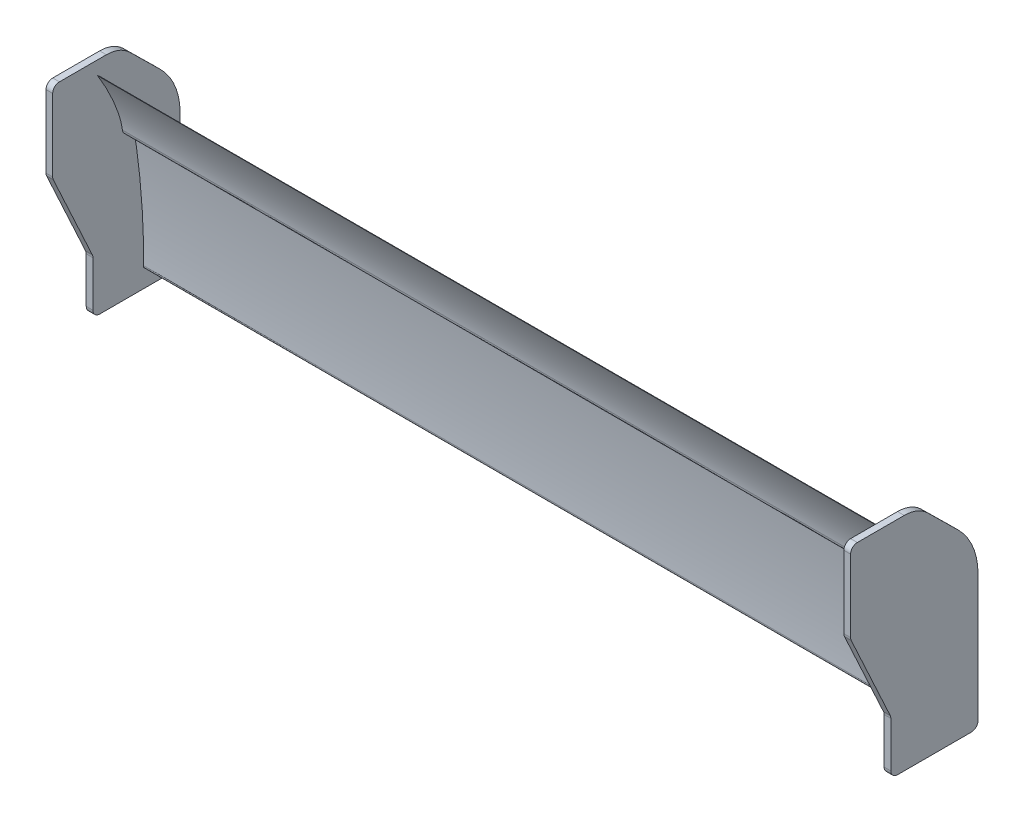
from build123d import *

# Parameters (mm, degrees)
AUFSATZ_LINEAR_AUSTRAGEN1_DEPTH = 1200
AUFSATZ_LINEAR_AUSTRAGEN2_DEPTH = 10
VERRUNDUNG1_R                   = 10
VERRUNDUNG2_R                   = 10
VERRUNDUNG3_R                   = 10
VERRUNDUNG4_R                   = 10
VERRUNDUNG5_R                   = 10
VERRUNDUNG6_R                   = 10
VERRUNDUNG7_R                   = 10
VERRUNDUNG8_R                   = 10
VERRUNDUNG9_R                   = 10


# Read off the part's stored shape, not the designer's step: Aufsatz-Linear austragen1
with BuildPart() as part:
    # Aufsatz-Linear austragen1 outline → Aufsatz-Linear austragen1 (new body)
    with BuildSketch(Plane.YZ):
        with BuildLine():
            add(Edge.make_bspline(
                [(0.087119677, 4.714982833), (-5.634033384, 4.866536556), (-4.617943663, -0.517961985), (1.551321063, -1.685315818)],
                knots=[0, 0, 0, 0, 1, 1, 1, 1], degree=3))
            add(Edge.make_bspline(
                [(1.551321063, -1.685315818), (36.200387324, -8.241643369), (130.194419575, -4.980681367), (200.000031119, 21.83636299)],
                knots=[0, 0, 0, 0, 1, 1, 1, 1], degree=3))
            add(Edge.make_bspline(
                [(200.000031119, 21.83636299), (128.317866722, 8.496380037), (49.556107203, 3.404546077), (0.087119677, 4.714982833)],
                knots=[0, 0, 0, 0, 1, 1, 1, 1], degree=3))
        make_face()
        with BuildLine():
            add(Edge.make_bspline(
                [(190.780024332, 35.996685389), (184.294419724, 35.173304352), (183.469094432, 31.558045666), (191.596944862, 31.529967587)],
                knots=[0, 0, 0, 0, 1, 1, 1, 1], degree=3))
            add(Edge.make_bspline(
                [(191.596944862, 31.529967587), (215.049703063, 31.448948823), (266.512020936, 54.325936425), (279.574089528, 73.098484798)],
                knots=[0, 0, 0, 0, 1, 1, 1, 1], degree=3))
            add(Edge.make_bspline(
                [(279.574089528, 73.098484798), (255.446232322, 58.126308272), (218.340693981, 39.495654893), (190.780024332, 35.996685389)],
                knots=[0, 0, 0, 0, 1, 1, 1, 1], degree=3))
        make_face()
    extrude(amount=AUFSATZ_LINEAR_AUSTRAGEN1_DEPTH)

    # Skizze2 → Aufsatz-Linear austragen2 (add)
    with BuildSketch(Plane.YZ):
        with BuildLine():
            Line((285.634273323, 24.925813413), (241.268546647, -20.148373173))
            ThreePointArc((241.268546647, -20.148373173), (208.633940277, -42.235669124), (170, -50))
            Line((170, -50), (-30, -50))
            Line((-30, -50), (-30, 80))
            Line((-30, 80), (50, 80))
            Line((50, 80), (180, 140))
            Line((180, 140), (300, 140))
            Line((300, 140), (300, 60))
            ThreePointArc((300, 60), (296.269394129, 41.048927025), (285.634273323, 24.925813413))
        make_face()
    aufsatz_linear_austragen2 = extrude(amount=AUFSATZ_LINEAR_AUSTRAGEN2_DEPTH)

    # Spiegeln4: Aufsatz-Linear austragen2 across plane
    add(aufsatz_linear_austragen2.mirror(Plane(origin=(600, 0, 0), x_dir=(0, 0, 1), z_dir=(1, 0, 0))))

    # Verrundung1
    verrundung1_edges = [part.edges().sort_by_distance(p)[0] for p in [
        (5, 300, 140),
    ]]
    fillet(verrundung1_edges, radius=VERRUNDUNG1_R)

    # Verrundung2
    verrundung2_edges = [part.edges().sort_by_distance(p)[0] for p in [
        (5, 180, 140),
    ]]
    fillet(verrundung2_edges, radius=VERRUNDUNG2_R)

    # Verrundung3
    verrundung3_edges = [part.edges().sort_by_distance(p)[0] for p in [
        (5, 50, 80),
    ]]
    fillet(verrundung3_edges, radius=VERRUNDUNG3_R)

    # Verrundung4
    verrundung4_edges = [part.edges().sort_by_distance(p)[0] for p in [
        (5, -30, 80),
        (5, -30, -50),
    ]]
    fillet(verrundung4_edges, radius=VERRUNDUNG4_R)

    # Verrundung5
    verrundung5_edges = [part.edges().sort_by_distance(p)[0] for p in [
        (1195, 300, 140),
    ]]
    fillet(verrundung5_edges, radius=VERRUNDUNG5_R)

    # Verrundung6
    verrundung6_edges = [part.edges().sort_by_distance(p)[0] for p in [
        (1195, 180, 140),
    ]]
    fillet(verrundung6_edges, radius=VERRUNDUNG6_R)

    # Verrundung7
    verrundung7_edges = [part.edges().sort_by_distance(p)[0] for p in [
        (1195, 50, 80),
    ]]
    fillet(verrundung7_edges, radius=VERRUNDUNG7_R)

    # Verrundung8
    verrundung8_edges = [part.edges().sort_by_distance(p)[0] for p in [
        (1195, -30, 80),
    ]]
    fillet(verrundung8_edges, radius=VERRUNDUNG8_R)

    # Verrundung9
    verrundung9_edges = [part.edges().sort_by_distance(p)[0] for p in [
        (1195, -30, -50),
    ]]
    fillet(verrundung9_edges, radius=VERRUNDUNG9_R)


solid = part.part
